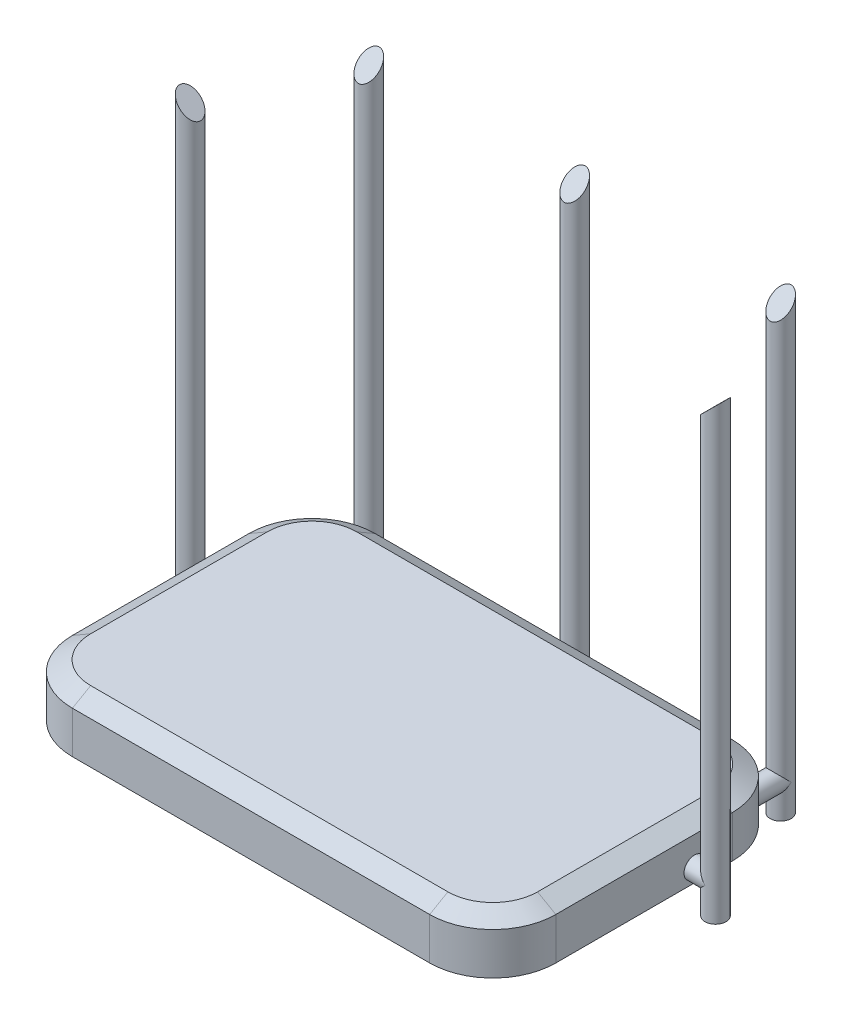
from build123d import *
from OCP.BRepFilletAPI import BRepFilletAPI_MakeChamfer

# Parameters (mm, degrees)
ESBO_O1_W                     = 230
ESBO_O1_H                     = 144
RESSALTO_EXTRUS_O1_DEPTH      = 37
ESBO_O2_R                     = 5
RESSALTO_EXTRUS_O2_DEPTH      = 10
RESSALTO_EXTRUS_O3_START      = -15
ESBO_O3_R                     = 5
RESSALTO_EXTRUS_O3_DEPTH      = 215
CORTE_EXTRUS_O1_DEPTH         = 56
ESBO_O6_R                     = 5
RESSALTO_EXTRUS_O4_DEPTH      = 10
RESSALTO_EXTRUS_O5_DEPTH      = 200
RESSALTO_EXTRUS_O5_DEPTH_BACK = 15
ESBO_O7_R                     = 5
CORTE_EXTRUS_O2_DEPTH         = 200
CORTE_EXTRUS_O2_DEPTH_BACK    = 200
FILETE1_START                 = -1
FILETE1_DEPTH                 = 39
FILETE1_START_2               = 23.5000001
FILETE1_2_DEPTH               = 14.4999999
FILETE1_3_DEPTH               = 14.499999761
FILETE1_START_3               = 23.281176651
FILETE1_4_DEPTH               = 9.810883349
FILETE1_START_4               = 13.499999761
FILETE1_5_DEPTH               = 9.78117689
FILETE1_6_DEPTH               = 0.218823449
FILETE1_START_5               = -72
FILETE1_7_OUTLINE_R           = 5
FILETE1_7_DEPTH               = 30
CHANFRO1_SIZE                 = 5
CHANFRO1_SIZE2                = 8.660254038
CHANFRO2_SIZE                 = 12
CHANFRO2_SIZE2                = 28.27022839


with BuildPart() as part:
    # Esboço1 → Ressalto-extrusão1 (new body)
    with BuildSketch(Plane(origin=(0, 0, 0), x_dir=(1, 0, 0), z_dir=(0, 1, 0))):
        Rectangle(ESBO_O1_W, ESBO_O1_H)
    extrude(amount=RESSALTO_EXTRUS_O1_DEPTH)

    # Esboço2 → Ressalto-extrusão2 (add)
    with BuildSketch(Plane(origin=(115, 0, 0), x_dir=(0, 0, -1), z_dir=(1, 0, 0))):
        with Locations(Location((24, 18.5, 0), (0, 0, 180))):
            Circle(ESBO_O2_R)
    ressalto_extrus_o2 = extrude(amount=RESSALTO_EXTRUS_O2_DEPTH)

    # Esboço3 → Ressalto-extrusão3 (add)
    with BuildSketch(Plane(origin=(0, 18.5, 0), x_dir=(1, 0, 0), z_dir=(0, 1, 0)).offset(RESSALTO_EXTRUS_O3_START)):
        with Locations(Location((125, 24, 0), (0, 0, 270))):
            Circle(ESBO_O3_R)
    ressalto_extrus_o3 = extrude(amount=RESSALTO_EXTRUS_O3_DEPTH)

    # Esboço4 → Corte-extrusão1 (cut)
    with BuildSketch(Plane.XY):
        Polygon((130, 218.5), (120, 208.57834268), (120, 218.5), align=None)
    corte_extrus_o1 = extrude(amount=-CORTE_EXTRUS_O1_DEPTH, mode=Mode.SUBTRACT)

    # Espelhar1: Ressalto-extrusão2, Ressalto-extrusão3, Corte-extrusão1 across plane
    add(ressalto_extrus_o2.mirror(Plane(origin=(0, 0, 0), x_dir=(0, 0, 1), z_dir=(1, 0, 0))))
    add(ressalto_extrus_o3.mirror(Plane(origin=(0, 0, 0), x_dir=(0, 0, 1), z_dir=(1, 0, 0))))
    add(corte_extrus_o1.mirror(Plane(origin=(0, 0, 0), x_dir=(0, 0, 1), z_dir=(1, 0, 0))), mode=Mode.SUBTRACT)

    # Esboço6 → Ressalto-extrusão4 (add)
    with BuildSketch(Plane(origin=(0, 0, -72), x_dir=(-1, 0, 0), z_dir=(0, 0, -1))):
        with Locations(Location((-98, 18.5, 0), (0, 0, 180))):
            Circle(ESBO_O6_R)
        with Locations(Location((0, 18.5, 0), (0, 0, 180))):
            Circle(ESBO_O6_R)
        with Locations(Location((98, 18.5, 0), (0, 0, 180))):
            Circle(ESBO_O6_R)
    extrude(amount=RESSALTO_EXTRUS_O4_DEPTH)

    # Esboço7 → Ressalto-extrusão5 (add, two sides: drawn at the far end of the back side and taken through both)
    with BuildSketch(Plane(origin=(0, 18.5, 0), x_dir=(1, 0, 0), z_dir=(0, 1, 0)).offset(-RESSALTO_EXTRUS_O5_DEPTH_BACK)):
        with Locations(Location((-98, 82, 0), (0, 0, 270))):
            Circle(ESBO_O7_R)
        with Locations(Location((0, 82, 0), (0, 0, 270))):
            Circle(ESBO_O7_R)
        with Locations(Location((98, 82, 0), (0, 0, 270))):
            Circle(ESBO_O7_R)
    extrude(amount=RESSALTO_EXTRUS_O5_DEPTH + RESSALTO_EXTRUS_O5_DEPTH_BACK)

    # Esboço8 → Corte-extrusão2 (cut, two sides: drawn at the far end of the back side and taken through both)
    with BuildSketch(Plane(origin=(0, 0, 0), x_dir=(0, 0, -1), z_dir=(1, 0, 0)).offset(-CORTE_EXTRUS_O2_DEPTH_BACK)):
        Polygon((87, 218.5), (77, 208.5), (77, 218.5), align=None)
    extrude(amount=CORTE_EXTRUS_O2_DEPTH + CORTE_EXTRUS_O2_DEPTH_BACK, mode=Mode.SUBTRACT)

    # Filete1: read off the stored shape, not the designer's step
    # Filete1 outline → Filete1 (cut)
    with BuildSketch(Plane(origin=(0, 0, 0), x_dir=(1, 0, 0), z_dir=(0, 1, 0)).offset(FILETE1_START)):
        with BuildLine():
            ThreePointArc((-85, -72), (-106.213203436, -63.213203436), (-115, -42))
            Line((-115, -42), (-115, -72))
            Line((-115, -72), (-85, -72))
        make_face()
        with BuildLine():
            ThreePointArc((115, -42), (106.213203436, -63.213203436), (85, -72))
            Line((85, -72), (115, -72))
            Line((115, -72), (115, -42))
        make_face()
    extrude(amount=FILETE1_DEPTH, mode=Mode.SUBTRACT)

    # Filete1 2 outline → Filete1 2 (cut)
    with BuildSketch(Plane(origin=(0, 0, 0), x_dir=(1, 0, 0), z_dir=(0, 1, 0)).offset(FILETE1_START_2)):
        with BuildLine():
            Line((-115, 72), (-115, 42))
            ThreePointArc((-115, 42), (-106.213203436, 63.213203436), (-85, 72))
            Line((-85, 72), (-115, 72))
        make_face()
        with BuildLine():
            Line((115, 72), (85, 72))
            ThreePointArc((85, 72), (106.213203436, 63.213203436), (115, 42))
            Line((115, 42), (115, 72))
        make_face()
    extrude(amount=FILETE1_2_DEPTH, mode=Mode.SUBTRACT)

    # Filete1 3 outline → Filete1 3 (cut)
    with BuildSketch(Plane(origin=(0, 0, 0), x_dir=(1, 0, 0), z_dir=(0, 1, 0)).offset(FILETE1_START)):
        with BuildLine():
            Line((-115, 72), (-115, 42))
            ThreePointArc((-115, 42), (-106.213203436, 63.213203436), (-85, 72))
            Line((-85, 72), (-115, 72))
        make_face()
        with BuildLine():
            Line((115, 72), (85, 72))
            ThreePointArc((85, 72), (106.213203436, 63.213203436), (115, 42))
            Line((115, 42), (115, 72))
        make_face()
    extrude(amount=FILETE1_3_DEPTH, mode=Mode.SUBTRACT)

    # Filete1 4 outline → Filete1 4 (cut)
    with BuildSketch(Plane(origin=(0, 0, 0), x_dir=(1, 0, 0), z_dir=(0, 1, 0)).offset(FILETE1_START_3)):
        with BuildLine():
            Line((115, 72), (85, 72))
            ThreePointArc((85, 72), (106.213203436, 63.213203436), (115, 42))
            Line((115, 42), (115, 72))
        make_face()
    extrude(amount=FILETE1_4_DEPTH, mode=Mode.SUBTRACT)

    # Filete1 5 outline → Filete1 5 (cut)
    with BuildSketch(Plane(origin=(0, 0, 0), x_dir=(1, 0, 0), z_dir=(0, 1, 0)).offset(FILETE1_START_4)):
        with BuildLine():
            Line((-115, 72), (-115, 42))
            ThreePointArc((-115, 42), (-106.213203436, 63.213203436), (-85, 72))
            Line((-85, 72), (-115, 72))
        make_face()
        with BuildLine():
            Line((115, 72), (85, 72))
            ThreePointArc((85, 72), (106.213203436, 63.213203436), (115, 42))
            Line((115, 42), (115, 72))
        make_face()
    extrude(amount=FILETE1_5_DEPTH, mode=Mode.SUBTRACT)

    # Filete1 6 outline → Filete1 6 (cut)
    with BuildSketch(Plane(origin=(0, 0, 0), x_dir=(1, 0, 0), z_dir=(0, 1, 0)).offset(FILETE1_START_3)):
        with BuildLine():
            Line((-115, 72), (-115, 42))
            ThreePointArc((-115, 42), (-106.213203436, 63.213203436), (-85, 72))
            Line((-85, 72), (-115, 72))
        make_face()
    extrude(amount=FILETE1_6_DEPTH, mode=Mode.SUBTRACT)

    # Filete1 7 outline → Filete1 7 (add)
    with BuildSketch(Plane.XY.offset(FILETE1_START_5)):
        with Locations((98, 18.5)):
            Circle(FILETE1_7_OUTLINE_R)
        with Locations((-98, 18.5)):
            Circle(FILETE1_7_OUTLINE_R)
    extrude(amount=FILETE1_7_DEPTH)

    # Chanfro1: one chamfer whose edges measure the first distance from different faces: ONE call of the kernel's chamfer builder (chamfer() names one face for all edges)
    chanfro1_edges_1 = [part.edges().sort_by_distance(p)[0] for p in [
        (-115, 37, 0),
    ]]
    chanfro1_side_1 = [part.faces().sort_by_distance(p)[0] for p in [
        (-115, 18.5, 0.622208406),
    ]]
    chanfro1_edges_2 = [part.edges().sort_by_distance(p)[0] for p in [
        (0, 37, -72),
    ]]
    chanfro1_side_2 = [part.faces().sort_by_distance(p)[0] for p in [
        (0, 1.739798839, -72),
    ]]
    chanfro1_edges_3 = [part.edges().sort_by_distance(p)[0] for p in [
        (0, 37, 72),
    ]]
    chanfro1_side_3 = [part.faces().sort_by_distance(p)[0] for p in [
        (0, 18.5, 72),
    ]]
    chanfro1_edges_4 = [part.edges().sort_by_distance(p)[0] for p in [
        (115, 37, 0),
    ]]
    chanfro1_side_4 = [part.faces().sort_by_distance(p)[0] for p in [
        (115, 18.5, 0.622208406),
    ]]
    chanfro1_edges_5 = [part.edges().sort_by_distance(p)[0] for p in [
        (-106.213203436, 37, 63.213203436),
    ]]
    chanfro1_side_5 = [part.faces().sort_by_distance(p)[0] for p in [
        (-106.213203436, 18.5, 63.213203436),
    ]]
    chanfro1_edges_6 = [part.edges().sort_by_distance(p)[0] for p in [
        (106.213203436, 37, 63.213203436),
    ]]
    chanfro1_side_6 = [part.faces().sort_by_distance(p)[0] for p in [
        (106.213203436, 18.5, 63.213203436),
    ]]
    chanfro1_edges_7 = [part.edges().sort_by_distance(p)[0] for p in [
        (106.213203436, 37, -63.213203436),
    ]]
    chanfro1_side_7 = [part.faces().sort_by_distance(p)[0] for p in [
        (106.213203436, 18.5, -63.213203436),
    ]]
    chanfro1_edges_8 = [part.edges().sort_by_distance(p)[0] for p in [
        (-106.213203436, 37, -63.213203436),
    ]]
    chanfro1_side_8 = [part.faces().sort_by_distance(p)[0] for p in [
        (-106.213203436, 18.5, -63.213203436),
    ]]
    chanfro1 = BRepFilletAPI_MakeChamfer(part.part.solid().wrapped)
    for e in chanfro1_edges_1:
        chanfro1.Add(CHANFRO1_SIZE, CHANFRO1_SIZE2, e.wrapped, chanfro1_side_1[0].wrapped)  # the first distance lies on this face
    for e in chanfro1_edges_2:
        chanfro1.Add(CHANFRO1_SIZE, CHANFRO1_SIZE2, e.wrapped, chanfro1_side_2[0].wrapped)  # the first distance lies on this face
    for e in chanfro1_edges_3:
        chanfro1.Add(CHANFRO1_SIZE, CHANFRO1_SIZE2, e.wrapped, chanfro1_side_3[0].wrapped)  # the first distance lies on this face
    for e in chanfro1_edges_4:
        chanfro1.Add(CHANFRO1_SIZE, CHANFRO1_SIZE2, e.wrapped, chanfro1_side_4[0].wrapped)  # the first distance lies on this face
    for e in chanfro1_edges_5:
        chanfro1.Add(CHANFRO1_SIZE, CHANFRO1_SIZE2, e.wrapped, chanfro1_side_5[0].wrapped)  # the first distance lies on this face
    for e in chanfro1_edges_6:
        chanfro1.Add(CHANFRO1_SIZE, CHANFRO1_SIZE2, e.wrapped, chanfro1_side_6[0].wrapped)  # the first distance lies on this face
    for e in chanfro1_edges_7:
        chanfro1.Add(CHANFRO1_SIZE, CHANFRO1_SIZE2, e.wrapped, chanfro1_side_7[0].wrapped)  # the first distance lies on this face
    for e in chanfro1_edges_8:
        chanfro1.Add(CHANFRO1_SIZE, CHANFRO1_SIZE2, e.wrapped, chanfro1_side_8[0].wrapped)  # the first distance lies on this face
    add(Compound.cast(chanfro1.Shape()), mode=Mode.REPLACE)

    # Chanfro2: one chamfer whose edges measure the first distance from different faces: ONE call of the kernel's chamfer builder (chamfer() names one face for all edges)
    chanfro2_edges_1 = [part.edges().sort_by_distance(p)[0] for p in [
        (-115, 0, 0),
    ]]
    chanfro2_side_1 = [part.faces().sort_by_distance(p)[0] for p in [
        (-115, 15.924754728, 0.72235461),
    ]]
    chanfro2_edges_2 = [part.edges().sort_by_distance(p)[0] for p in [
        (0, 0, -72),
    ]]
    chanfro2_side_2 = [part.faces().sort_by_distance(p)[0] for p in [
        (83.270144515, 16, -72),
    ]]
    chanfro2_edges_3 = [part.edges().sort_by_distance(p)[0] for p in [
        (115, 0, 0),
    ]]
    chanfro2_side_3 = [part.faces().sort_by_distance(p)[0] for p in [
        (115, 15.924754728, 0.72235461),
    ]]
    chanfro2_edges_4 = [part.edges().sort_by_distance(p)[0] for p in [
        (0, 0, 72),
    ]]
    chanfro2_side_4 = [part.faces().sort_by_distance(p)[0] for p in [
        (0, 16, 72),
    ]]
    chanfro2_edges_5 = [part.edges().sort_by_distance(p)[0] for p in [
        (-106.213203436, 0, 63.213203436),
    ]]
    chanfro2_side_5 = [part.faces().sort_by_distance(p)[0] for p in [
        (-106.213203436, 16, 63.213203436),
    ]]
    chanfro2_edges_6 = [part.edges().sort_by_distance(p)[0] for p in [
        (106.213203436, 0, 63.213203436),
    ]]
    chanfro2_side_6 = [part.faces().sort_by_distance(p)[0] for p in [
        (106.213203436, 16, 63.213203436),
    ]]
    chanfro2_edges_7 = [part.edges().sort_by_distance(p)[0] for p in [
        (106.213203436, 0, -63.213203436),
    ]]
    chanfro2_side_7 = [part.faces().sort_by_distance(p)[0] for p in [
        (106.213203436, 16, -63.213203436),
    ]]
    chanfro2_edges_8 = [part.edges().sort_by_distance(p)[0] for p in [
        (-106.213203436, 0, -63.213203436),
    ]]
    chanfro2_side_8 = [part.faces().sort_by_distance(p)[0] for p in [
        (-106.213203436, 16, -63.213203436),
    ]]
    chanfro2 = BRepFilletAPI_MakeChamfer(part.part.solid().wrapped)
    for e in chanfro2_edges_1:
        chanfro2.Add(CHANFRO2_SIZE, CHANFRO2_SIZE2, e.wrapped, chanfro2_side_1[0].wrapped)  # the first distance lies on this face
    for e in chanfro2_edges_2:
        chanfro2.Add(CHANFRO2_SIZE, CHANFRO2_SIZE2, e.wrapped, chanfro2_side_2[0].wrapped)  # the first distance lies on this face
    for e in chanfro2_edges_3:
        chanfro2.Add(CHANFRO2_SIZE, CHANFRO2_SIZE2, e.wrapped, chanfro2_side_3[0].wrapped)  # the first distance lies on this face
    for e in chanfro2_edges_4:
        chanfro2.Add(CHANFRO2_SIZE, CHANFRO2_SIZE2, e.wrapped, chanfro2_side_4[0].wrapped)  # the first distance lies on this face
    for e in chanfro2_edges_5:
        chanfro2.Add(CHANFRO2_SIZE, CHANFRO2_SIZE2, e.wrapped, chanfro2_side_5[0].wrapped)  # the first distance lies on this face
    for e in chanfro2_edges_6:
        chanfro2.Add(CHANFRO2_SIZE, CHANFRO2_SIZE2, e.wrapped, chanfro2_side_6[0].wrapped)  # the first distance lies on this face
    for e in chanfro2_edges_7:
        chanfro2.Add(CHANFRO2_SIZE, CHANFRO2_SIZE2, e.wrapped, chanfro2_side_7[0].wrapped)  # the first distance lies on this face
    for e in chanfro2_edges_8:
        chanfro2.Add(CHANFRO2_SIZE, CHANFRO2_SIZE2, e.wrapped, chanfro2_side_8[0].wrapped)  # the first distance lies on this face
    add(Compound.cast(chanfro2.Shape()), mode=Mode.REPLACE)


solid = part.part
